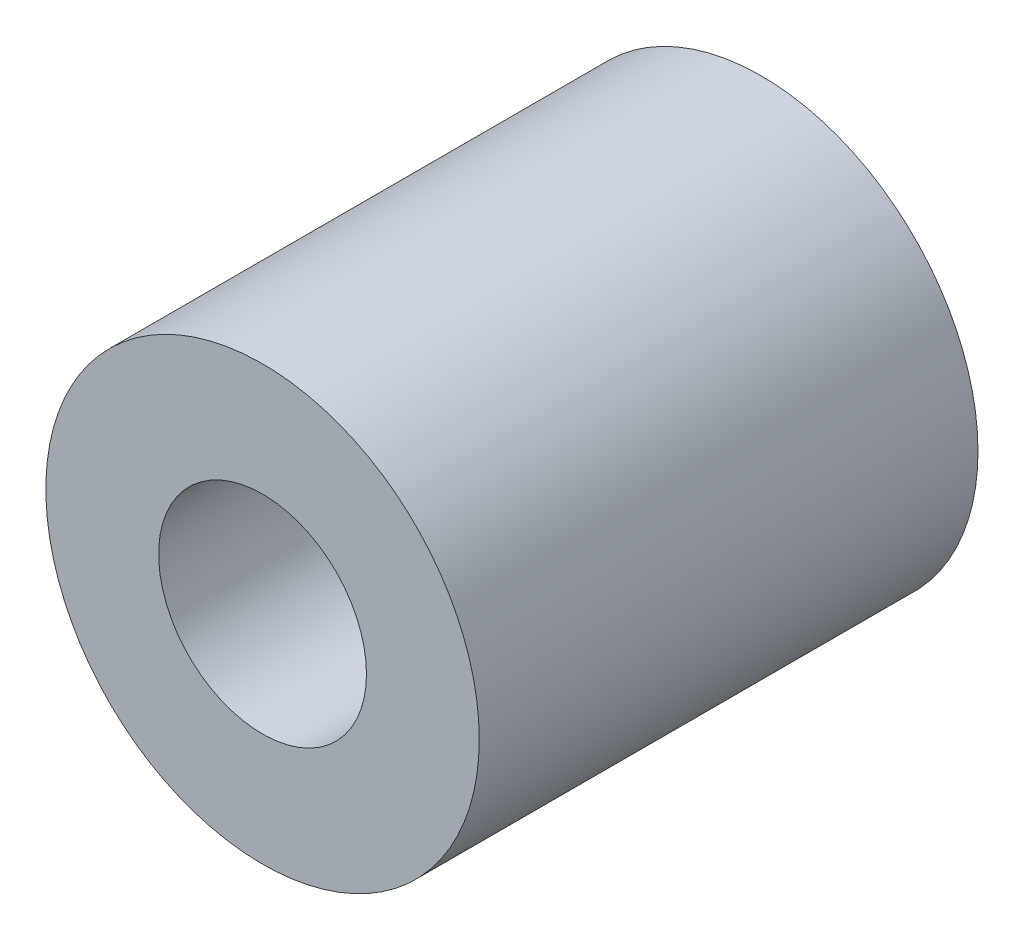
from build123d import *

# Parameters (mm, degrees)
SKETCH2_R           = 43.45
SKETCH2_R_2         = 20.8375
BOSS_EXTRUDE1_DEPTH = 100


with BuildPart() as part:
    # Sketch2 → Boss-Extrude1 (new body)
    with BuildSketch(Plane.XY):
        Circle(SKETCH2_R)
        Circle(SKETCH2_R_2, mode=Mode.SUBTRACT)
    extrude(amount=BOSS_EXTRUDE1_DEPTH)


solid = part.part
